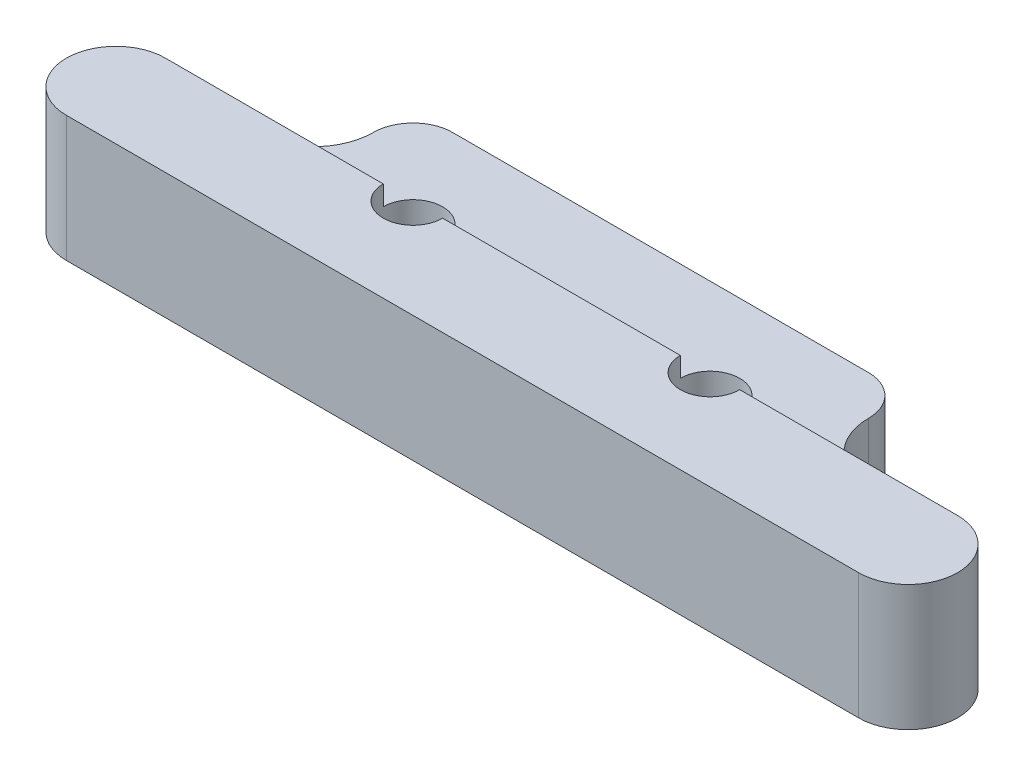
from build123d import *

# Parameters (mm, degrees)
BOSS_EXTRUDE1_DEPTH         = 6.35
TAP_DRILL_FOR_M4X0_7_TAP1_D = 3
FILLET1_R                   = 3
CUT_EXTRUDE1_START          = -7.5
CUT_EXTRUDE1_OUTLINE_W      = 34
CUT_EXTRUDE1_OUTLINE_H      = 1
CUT_EXTRUDE1_DEPTH          = 5


# Read off the part's stored shape, not the designer's step: Cut-Extrude1
with BuildPart() as part:
    # Sketch1 → Boss-Extrude1 (new body)
    with BuildSketch(Plane(origin=(0, 0, 0), x_dir=(1, 0, 0), z_dir=(0, 1, 0))):
        with BuildLine():
            Line((-20, -2.5), (20, -2.5))
            ThreePointArc((20, -2.5), (22.5, 0), (20, 2.5))
            Line((20, 2.5), (-20, 2.5))
            ThreePointArc((-20, 2.5), (-22.5, 0), (-20, -2.5))
        make_face()
        with BuildLine():
            Line((-12.5, 5.5), (-12.5, 2.5))
            Line((-12.5, 2.5), (12.5, 2.5))
            Line((12.5, 2.5), (12.5, 5.5))
            ThreePointArc((12.5, 5.5), (11.914213562, 6.914213562), (10.5, 7.5))
            Line((10.5, 7.5), (-10.5, 7.5))
            ThreePointArc((-10.5, 7.5), (-11.914213562, 6.914213562), (-12.5, 5.5))
        make_face()
    extrude(amount=BOSS_EXTRUDE1_DEPTH)

    # Tap Drill for M4x0.7 Tap1 (through all)
    with Locations(Plane(origin=(0, 6.35, 0), x_dir=(1, 0, 0), z_dir=(0, 1, 0))):
        with Locations((-7.5, 2.5), (7.5, 2.5)):
            Hole(TAP_DRILL_FOR_M4X0_7_TAP1_D / 2)

    # Fillet1
    fillet1_edges = [part.edges().sort_by_distance(p)[0] for p in [
        (12.5, 3.175, -2.5),
        (-12.5, 3.175, -2.5),
    ]]
    fillet(fillet1_edges, radius=FILLET1_R - 0.0001)  # a hair under: the kernel refuses the full size

    # Cut-Extrude1 outline → Cut-Extrude1 (cut)
    with BuildSketch(Plane.XY.offset(CUT_EXTRUDE1_START)):
        with Locations((0, 5.85)):
            Rectangle(CUT_EXTRUDE1_OUTLINE_W, CUT_EXTRUDE1_OUTLINE_H)
    extrude(amount=CUT_EXTRUDE1_DEPTH, mode=Mode.SUBTRACT)


solid = part.part
